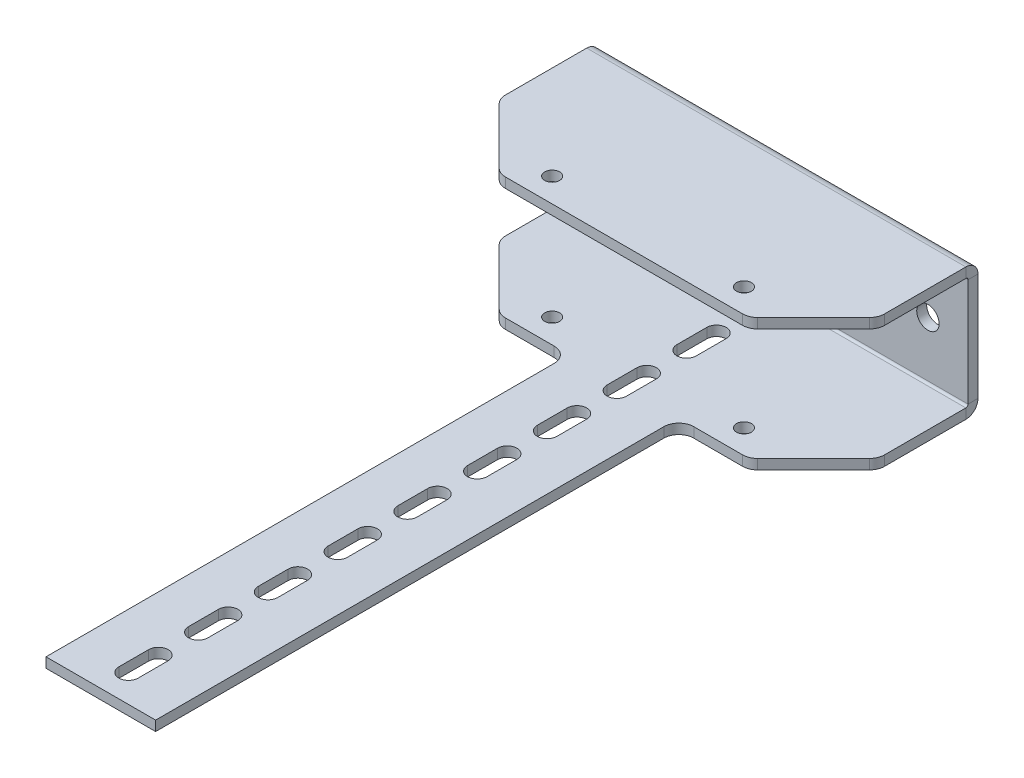
from build123d import *

# Parameters (mm, degrees)
BASE_FLANGE1_DEPTH  = 76.09
SKETCH6_W           = 22
SKETCH6_H           = 2
BOSS_EXTRUDE1_DEPTH = 105
FILLET2_R           = 3
CHAMFER1_SIZE       = 13
CHAMFER2_SIZE       = 13
FILLET3_R           = 3
CUT_EXTRUDE1_REACH  = 134.352
CUT_EXTRUDE2_REACH  = 134.352
SKETCH7_3_R         = 1.5
CUT_EXTRUDE3_REACH  = 161.48
SKETCH8_R           = 2.25


# Sheet-metal steps are written as plain solids
with BuildPart() as part:
    # Sketch1 → Base-Flange1 (new body)
    with BuildSketch(Plane(origin=(0, 0, 0), x_dir=(0, 0, -1), z_dir=(1, 0, 0))):
        with BuildLine():
            Line((0, 0), (30.56, 0))
            ThreePointArc((30.56, 0), (30.871126984, 0.128873016), (31, 0.44))
            Line((31, 0.44), (31, 22.06))
            ThreePointArc((31, 22.06), (30.871126984, 22.371126984), (30.56, 22.5))
            Line((30.56, 22.5), (0, 22.5))
            Line((0, 22.5), (0, 24.5))
            Line((0, 24.5), (30.56, 24.5))
            ThreePointArc((30.56, 24.5), (32.285340546, 23.785340546), (33, 22.06))
            Line((33, 22.06), (33, 0.44))
            ThreePointArc((33, 0.44), (32.285340546, -1.285340546), (30.56, -2))
            Line((30.56, -2), (0, -2))
            Line((0, -2), (0, 0))
        make_face()
    extrude(amount=BASE_FLANGE1_DEPTH)

    # Sketch6 → Boss-Extrude1 (add)
    with BuildSketch(Plane.XY):
        with Locations((38.045, -1)):
            Rectangle(SKETCH6_W, SKETCH6_H)
    extrude(amount=BOSS_EXTRUDE1_DEPTH)

    # Fillet2
    fillet2_edges = [part.edges().sort_by_distance(p)[0] for p in [
        (49.045, -1, 0),
        (27.045, -1, 0),
    ]]
    fillet(fillet2_edges, radius=FILLET2_R)

    # Chamfer1
    chamfer1_edges = [part.edges().sort_by_distance(p)[0] for p in [
        (0, -1, 0),
        (0, 23.5, 0),
    ]]
    chamfer(chamfer1_edges, length=CHAMFER1_SIZE)

    # Chamfer2
    chamfer2_edges = [part.edges().sort_by_distance(p)[0] for p in [
        (76.09, -1, 0),
        (76.09, 23.5, 0),
    ]]
    chamfer(chamfer2_edges, length=CHAMFER2_SIZE)

    # Fillet3
    fillet3_edges = [part.edges().sort_by_distance(p)[0] for p in [
        (76.09, -1, -13),
        (76.09, 23.5, -13),
        (63.09, -1, 0),
        (63.09, 23.5, 0),
        (13, 23.5, 0),
        (13, -1, 0),
        (0, -1, -13),
        (0, 23.5, -13),
    ]]
    fillet(fillet3_edges, radius=FILLET3_R)

    # Sketch7 → Cut-Extrude1 (cut, up to next)
    with BuildSketch(Plane.XZ.offset(2), mode=Mode.PRIVATE) as cut_extrude1_sk1:
        with BuildLine():
            Line((39.995, -18.56), (39.995, -12.56))
            ThreePointArc((39.995, -12.56), (38.045, -10.61), (36.095, -12.56))
            Line((36.095, -12.56), (36.095, -18.56))
            ThreePointArc((36.095, -18.56), (38.045, -20.51), (39.995, -18.56))
        make_face()
    cut_extrude1_tool1 = extrude(cut_extrude1_sk1.sketch, amount=-CUT_EXTRUDE1_REACH, mode=Mode.PRIVATE) & part.part
    # Sketch7 → Cut-Extrude1 (cut, up to next)
    with BuildSketch(Plane.XZ.offset(2), mode=Mode.PRIVATE) as cut_extrude1_sk2:
        with BuildLine():
            Line((39.995, -4.56), (39.995, 1.44))
            ThreePointArc((39.995, 1.44), (38.045, 3.39), (36.095, 1.44))
            Line((36.095, 1.44), (36.095, -4.56))
            ThreePointArc((36.095, -4.56), (38.045, -6.51), (39.995, -4.56))
        make_face()
    cut_extrude1_tool2 = extrude(cut_extrude1_sk2.sketch, amount=-CUT_EXTRUDE1_REACH, mode=Mode.PRIVATE) & part.part
    # Sketch7 → Cut-Extrude1 (cut, up to next)
    with BuildSketch(Plane.XZ.offset(2), mode=Mode.PRIVATE) as cut_extrude1_sk3:
        with BuildLine():
            Line((39.995, 9.44), (39.995, 15.44))
            ThreePointArc((39.995, 15.44), (38.045, 17.39), (36.095, 15.44))
            Line((36.095, 15.44), (36.095, 9.44))
            ThreePointArc((36.095, 9.44), (38.045, 7.49), (39.995, 9.44))
        make_face()
    cut_extrude1_tool3 = extrude(cut_extrude1_sk3.sketch, amount=-CUT_EXTRUDE1_REACH, mode=Mode.PRIVATE) & part.part
    # Sketch7 → Cut-Extrude1 (cut, up to next)
    with BuildSketch(Plane.XZ.offset(2), mode=Mode.PRIVATE) as cut_extrude1_sk4:
        with BuildLine():
            Line((39.995, 23.44), (39.995, 29.44))
            ThreePointArc((39.995, 29.44), (38.045, 31.39), (36.095, 29.44))
            Line((36.095, 29.44), (36.095, 23.44))
            ThreePointArc((36.095, 23.44), (38.045, 21.49), (39.995, 23.44))
        make_face()
    cut_extrude1_tool4 = extrude(cut_extrude1_sk4.sketch, amount=-CUT_EXTRUDE1_REACH, mode=Mode.PRIVATE) & part.part
    # Sketch7 → Cut-Extrude1 (cut, up to next)
    with BuildSketch(Plane.XZ.offset(2), mode=Mode.PRIVATE) as cut_extrude1_sk5:
        with BuildLine():
            Line((39.995, 37.44), (39.995, 43.44))
            ThreePointArc((39.995, 43.44), (38.045, 45.39), (36.095, 43.44))
            Line((36.095, 43.44), (36.095, 37.44))
            ThreePointArc((36.095, 37.44), (38.045, 35.49), (39.995, 37.44))
        make_face()
    cut_extrude1_tool5 = extrude(cut_extrude1_sk5.sketch, amount=-CUT_EXTRUDE1_REACH, mode=Mode.PRIVATE) & part.part
    # Sketch7 → Cut-Extrude1 (cut, up to next)
    with BuildSketch(Plane.XZ.offset(2), mode=Mode.PRIVATE) as cut_extrude1_sk6:
        with BuildLine():
            Line((39.995, 51.44), (39.995, 57.44))
            ThreePointArc((39.995, 57.44), (38.045, 59.39), (36.095, 57.44))
            Line((36.095, 57.44), (36.095, 51.44))
            ThreePointArc((36.095, 51.44), (38.045, 49.49), (39.995, 51.44))
        make_face()
    cut_extrude1_tool6 = extrude(cut_extrude1_sk6.sketch, amount=-CUT_EXTRUDE1_REACH, mode=Mode.PRIVATE) & part.part
    # Sketch7 → Cut-Extrude1 (cut, up to next)
    with BuildSketch(Plane.XZ.offset(2), mode=Mode.PRIVATE) as cut_extrude1_sk7:
        with BuildLine():
            Line((39.995, 65.44), (39.995, 71.44))
            ThreePointArc((39.995, 71.44), (38.045, 73.39), (36.095, 71.44))
            Line((36.095, 71.44), (36.095, 65.44))
            ThreePointArc((36.095, 65.44), (38.045, 63.49), (39.995, 65.44))
        make_face()
    cut_extrude1_tool7 = extrude(cut_extrude1_sk7.sketch, amount=-CUT_EXTRUDE1_REACH, mode=Mode.PRIVATE) & part.part
    # Sketch7 → Cut-Extrude1 (cut, up to next)
    with BuildSketch(Plane.XZ.offset(2), mode=Mode.PRIVATE) as cut_extrude1_sk8:
        with BuildLine():
            Line((39.995, 79.44), (39.995, 85.44))
            ThreePointArc((39.995, 85.44), (38.045, 87.39), (36.095, 85.44))
            Line((36.095, 85.44), (36.095, 79.44))
            ThreePointArc((36.095, 79.44), (38.045, 77.49), (39.995, 79.44))
        make_face()
    cut_extrude1_tool8 = extrude(cut_extrude1_sk8.sketch, amount=-CUT_EXTRUDE1_REACH, mode=Mode.PRIVATE) & part.part
    # Sketch7 → Cut-Extrude1 (cut, up to next)
    with BuildSketch(Plane.XZ.offset(2), mode=Mode.PRIVATE) as cut_extrude1_sk9:
        with BuildLine():
            Line((39.995, 93.44), (39.995, 99.44))
            ThreePointArc((39.995, 99.44), (38.045, 101.39), (36.095, 99.44))
            Line((36.095, 99.44), (36.095, 93.44))
            ThreePointArc((36.095, 93.44), (38.045, 91.49), (39.995, 93.44))
        make_face()
    cut_extrude1_tool9 = extrude(cut_extrude1_sk9.sketch, amount=-CUT_EXTRUDE1_REACH, mode=Mode.PRIVATE) & part.part
    add(cut_extrude1_tool1.solids().sort_by_distance((38.045, -2, -15.56))[0], mode=Mode.SUBTRACT)
    add(cut_extrude1_tool2.solids().sort_by_distance((38.045, -2, -1.56))[0], mode=Mode.SUBTRACT)
    add(cut_extrude1_tool3.solids().sort_by_distance((38.045, -2, 12.44))[0], mode=Mode.SUBTRACT)
    add(cut_extrude1_tool4.solids().sort_by_distance((38.045, -2, 26.44))[0], mode=Mode.SUBTRACT)
    add(cut_extrude1_tool5.solids().sort_by_distance((38.045, -2, 40.44))[0], mode=Mode.SUBTRACT)
    add(cut_extrude1_tool6.solids().sort_by_distance((38.045, -2, 54.44))[0], mode=Mode.SUBTRACT)
    add(cut_extrude1_tool7.solids().sort_by_distance((38.045, -2, 68.44))[0], mode=Mode.SUBTRACT)
    add(cut_extrude1_tool8.solids().sort_by_distance((38.045, -2, 82.44))[0], mode=Mode.SUBTRACT)
    add(cut_extrude1_tool9.solids().sort_by_distance((38.045, -2, 96.44))[0], mode=Mode.SUBTRACT)

    # Cut-Extrude2: up to this face of the body (flat: up to its plane)
    cut_extrude2_end = Plane(part.part.faces().sort_by_distance((38.045, 24.5, -16.141358018))[0])
    # Sketch7<3> → Cut-Extrude2 (cut, up to the picked face)
    with BuildSketch(Plane.XZ.offset(2), mode=Mode.PRIVATE) as cut_extrude2_sk1:
        with Locations(Location((18.8, -4.83, 0), (0, 0, 270))):
            Circle(SKETCH7_3_R)
    cut_extrude2_tool1 = split(extrude(cut_extrude2_sk1.sketch, amount=-CUT_EXTRUDE2_REACH, mode=Mode.PRIVATE), bisect_by=cut_extrude2_end, keep=Keep.BOTH, mode=Mode.PRIVATE)
    # Sketch7<3> → Cut-Extrude2 (cut, up to the picked face)
    with BuildSketch(Plane.XZ.offset(2), mode=Mode.PRIVATE) as cut_extrude2_sk2:
        with Locations(Location((57.29, -4.83, 0), (0, 0, 270))):
            Circle(SKETCH7_3_R)
    cut_extrude2_tool2 = split(extrude(cut_extrude2_sk2.sketch, amount=-CUT_EXTRUDE2_REACH, mode=Mode.PRIVATE), bisect_by=cut_extrude2_end, keep=Keep.BOTH, mode=Mode.PRIVATE)
    add(cut_extrude2_tool1.solids().sort_by(Axis((18.8, -2, -4.83), (0, 1, 0)))[0], mode=Mode.SUBTRACT)
    add(cut_extrude2_tool2.solids().sort_by(Axis((57.29, -2, -4.83), (0, 1, 0)))[0], mode=Mode.SUBTRACT)

    # Sketch8 → Cut-Extrude3 (cut, up to next)
    with BuildSketch(Plane(origin=(0, 0, -33), x_dir=(-1, 0, 0), z_dir=(0, 0, -1)), mode=Mode.PRIVATE) as cut_extrude3_sk1:
        with Locations((-8.05, 11.5)):
            Circle(SKETCH8_R)
    cut_extrude3_tool1 = extrude(cut_extrude3_sk1.sketch, amount=-CUT_EXTRUDE3_REACH, mode=Mode.PRIVATE) & part.part
    # Sketch8 → Cut-Extrude3 (cut, up to next)
    with BuildSketch(Plane(origin=(0, 0, -33), x_dir=(-1, 0, 0), z_dir=(0, 0, -1)), mode=Mode.PRIVATE) as cut_extrude3_sk2:
        with Locations((-68.04, 11.5)):
            Circle(SKETCH8_R)
    cut_extrude3_tool2 = extrude(cut_extrude3_sk2.sketch, amount=-CUT_EXTRUDE3_REACH, mode=Mode.PRIVATE) & part.part
    add(cut_extrude3_tool1.solids().sort_by_distance((8.05, 11.5, -33))[0], mode=Mode.SUBTRACT)
    add(cut_extrude3_tool2.solids().sort_by_distance((68.04, 11.5, -33))[0], mode=Mode.SUBTRACT)


solid = part.part
